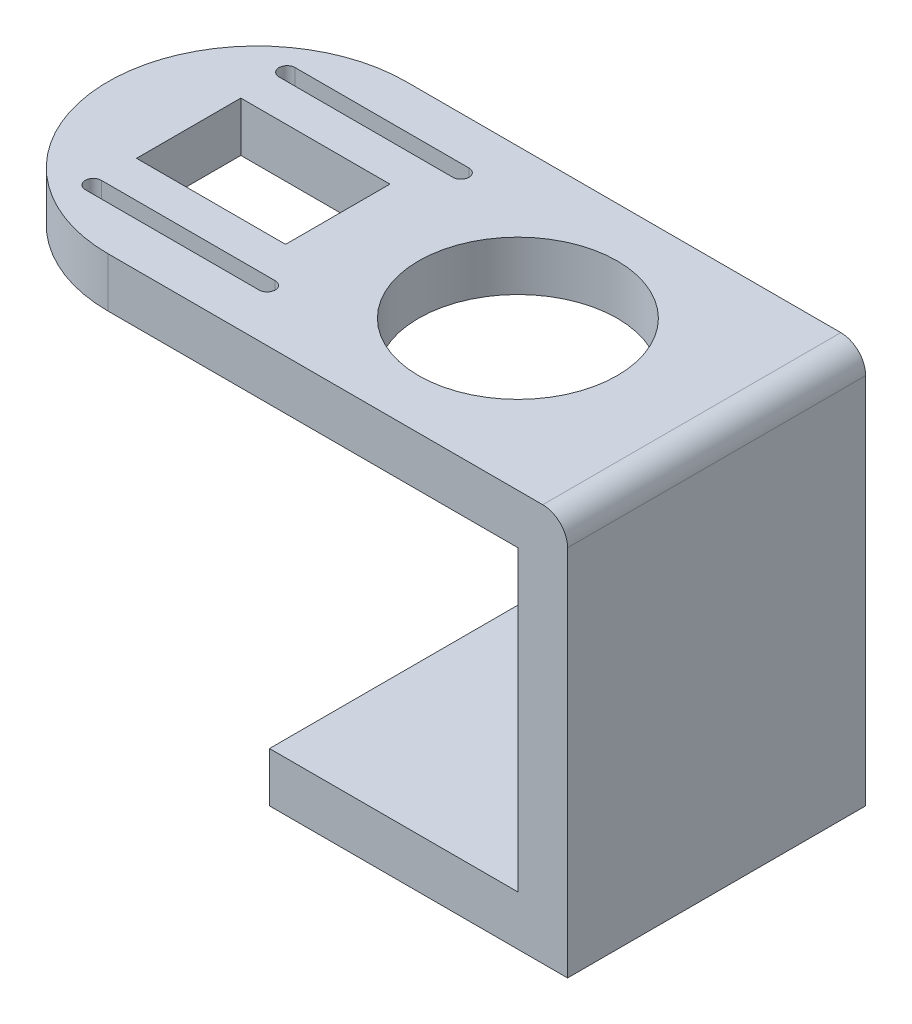
from build123d import *

# Parameters (mm, degrees)
SKETCH4_W                    = 20
SKETCH4_H                    = 120
SKETCH4_W_2                  = 120
SKETCH4_H_2                  = 20
SKETCH4_W_3                  = 160
BOSS_EXTRUDE3_DEPTH          = 120
BOSS_EXTRUDE4_DEPTH          = 20
SKETCH21_R                   = 40
CUT_EXTRUDE3_DEPTH           = 25
SKETCH24_W                   = 15
SKETCH24_H                   = 20
SPLIT1_START                 = 97.450277265
SPLIT1_OUTLINE_R             = 45
SPLIT1_OUTLINE_R_2           = 25.75
SPLIT1_DEPTH                 = 42.549722735
SPLIT1_2_DEPTH               = 42.549722735
SPLIT1_3_OUTLINE_R           = 25.75
SPLIT1_3_DEPTH               = 6
SPLIT1_START_2               = 103.450277265
SPLIT1_4_DEPTH               = 8.549722735
SPLIT1_START_3               = 132
SPLIT1_5_DEPTH               = 8
F_5_0_5_DIAMETER_HOLE1_D     = 5
F_5_0_5_DIAMETER_HOLE1_DEPTH = 2.497848452
F_5_0_5_DIAMETER_HOLE1_TIP   = 1.502151548
CUT_EXTRUDE4_DEPTH           = 317.267292017
CUT_EXTRUDE5_DEPTH           = 307.634962129
CUT_EXTRUDE5_DEPTH_BACK      = 307.634962129
FILLET1_R                    = 10


# Read off the part's stored shape, not the designer's step: Split1
with BuildPart() as part:
    # Sketch4 → Boss-Extrude3 (new body)
    with BuildSketch(Plane.XY):
        with Locations((-10, 80)):
            Rectangle(SKETCH4_W, SKETCH4_H)
        with Locations((-60, 10)):
            Rectangle(SKETCH4_W_2, SKETCH4_H_2)
        with Locations((-80, 150)):
            Rectangle(SKETCH4_W_3, SKETCH4_H_2)
    extrude(amount=BOSS_EXTRUDE3_DEPTH)

    # Sketch20 → Boss-Extrude4 (add)
    with BuildSketch(Plane(origin=(0, 160, 0), x_dir=(1, 0, 0), z_dir=(0, 1, 0))):
        with BuildLine():
            Line((-185, -120), (-160, -120))
            Line((-160, -120), (-160, 0))
            Line((-160, 0), (-185, 0))
            ThreePointArc((-185, 0), (-245, -60), (-185, -120))
        make_face()
    extrude(amount=-BOSS_EXTRUDE4_DEPTH)

    # Sketch21 → Cut-Extrude3 (cut)
    with BuildSketch(Plane.XZ.offset(-140)):
        with Locations(Location((-80, 60, 0), (0, 0, 270))):
            Circle(SKETCH21_R)
    extrude(amount=-CUT_EXTRUDE3_DEPTH, mode=Mode.SUBTRACT)

    # Sketch23 → Revolve1 (revolve)
    with BuildSketch(Plane(origin=(0, 0, 60), x_dir=(-1, 0, 0), z_dir=(0, 0, -1)), mode=Mode.PRIVATE) as revolve1_sk:
        Polygon((125, 140), (120, 140), (120, 103.450277265), (105.75, 103.450277265), (105.75, 97.450277265), (125, 97.450277265), align=None)
    revolve(revolve1_sk.sketch.rotate(Axis((-80, 160, 60), (0, -1, 0)), 270), axis=Axis((-80, 160, 60), (0, -1, 0)))

    # Cut-Sweep1: sweep along a path in Sketch25
    with BuildLine(Plane(origin=(0, 132, 0), x_dir=(-1, 0, 0), z_dir=(0, -1, 0))) as cut_sweep1_path:
        Line((125, -80.343984431), (80, -90))
        ThreePointArc((80, -90), (50, -60), (80, -30))
        Line((80, -30), (125, -39.656015569))
    # Sketch24 → Cut-Sweep1 (sweep, cut)
    with BuildSketch(Plane.ZY.offset(125)):
        with Locations((37.5, 122)):
            Rectangle(SKETCH24_W, SKETCH24_H)
    sweep(path=cut_sweep1_path.line, transition=Transition.RIGHT, mode=Mode.SUBTRACT)

    # Split1 outline → Split1 (cut)
    with BuildSketch(Plane(origin=(0, 0, 0), x_dir=(1, 0, 0), z_dir=(0, 1, 0)).offset(SPLIT1_START)):
        with Locations((-80, -60)):
            Circle(SPLIT1_OUTLINE_R)
        with Locations((-80, -60)):
            Circle(SPLIT1_OUTLINE_R_2, mode=Mode.SUBTRACT)
    extrude(amount=SPLIT1_DEPTH, mode=Mode.SUBTRACT)

    # Ø5.0 (5) Diameter Hole1
    with Locations(Plane(origin=(0, 140, 0), x_dir=(-1, 0, 0), z_dir=(0, -1, 0))):
        with Locations((53.75, -14.533666301), (132.5, -60), (53.75, -105.466333699)):
            Hole(F_5_0_5_DIAMETER_HOLE1_D / 2, depth=F_5_0_5_DIAMETER_HOLE1_DEPTH)
            with Locations((0, 0, -(F_5_0_5_DIAMETER_HOLE1_DEPTH + F_5_0_5_DIAMETER_HOLE1_TIP / 2))):  # 118° drill point
                Cone(0, F_5_0_5_DIAMETER_HOLE1_D / 2, F_5_0_5_DIAMETER_HOLE1_TIP, mode=Mode.SUBTRACT)

    # Sketch19 → Cut-Extrude4 (cut, through all)
    with BuildSketch(Plane(origin=(0, 160, 0), x_dir=(1, 0, 0), z_dir=(0, 1, 0))):
        Polygon((-152.526760948, -69.999980109), (-152.526760948, -81), (-212.526760948, -81), (-212.526760948, -39), (-152.526760948, -39), (-152.526760948, -50.000019891), align=None)
    extrude(amount=-CUT_EXTRUDE4_DEPTH, mode=Mode.SUBTRACT)

    # Sketch30 → Cut-Extrude5 (cut, two sides: drawn at the far end of the back side and taken through both)
    with BuildSketch(Plane.XZ.offset(-140).offset(-CUT_EXTRUDE5_DEPTH_BACK)):
        with BuildLine():
            Line((-212.234124069, 23.95), (-142.234124069, 23.95))
            ThreePointArc((-142.234124069, 23.95), (-138.984124069, 20.7), (-142.234124069, 17.45))
            Line((-142.234124069, 17.45), (-212.234124069, 17.45))
            ThreePointArc((-212.234124069, 17.45), (-215.484124069, 20.7), (-212.234124069, 23.95))
        make_face()
        with BuildLine():
            Line((-211.937175822, 102.25), (-141.937175822, 102.25))
            ThreePointArc((-141.937175822, 102.25), (-138.687175822, 99), (-141.937175822, 95.75))
            Line((-141.937175822, 95.75), (-211.937175822, 95.75))
            ThreePointArc((-211.937175822, 95.75), (-215.187175822, 99), (-211.937175822, 102.25))
        make_face()
    extrude(amount=CUT_EXTRUDE5_DEPTH + CUT_EXTRUDE5_DEPTH_BACK, mode=Mode.SUBTRACT)

    # Fillet1
    fillet1_edges = [part.edges().sort_by_distance(p)[0] for p in [
        (0, 160, 60),
    ]]
    fillet(fillet1_edges, radius=FILLET1_R)


with BuildPart() as body_2:
    # Split1 2 outline → Split1 2 (new body)
    with BuildSketch(Plane(origin=(0, 0, 0), x_dir=(1, 0, 0), z_dir=(0, 1, 0)).offset(SPLIT1_START)):
        with BuildLine():
            ThreePointArc((-97.74561888, -24.151806035), (-40, -60), (-97.74561888, -95.848193965))
            Line((-97.74561888, -95.848193965), (-110.465485891, -93.118788767))
            ThreePointArc((-110.465485891, -93.118788767), (-35, -60), (-110.465485891, -26.881211233))
            Line((-110.465485891, -26.881211233), (-97.74561888, -24.151806035))
        make_face()
        with BuildLine():
            ThreePointArc((-116.266630075, -76.873990133), (-120, -60), (-116.266630075, -43.126009867))
            Line((-116.266630075, -43.126009867), (-122.209965285, -44.401319586))
            ThreePointArc((-122.209965285, -44.401319586), (-125, -60), (-122.209965285, -75.598680414))
            Line((-122.209965285, -75.598680414), (-116.266630075, -76.873990133))
        make_face()
    extrude(amount=SPLIT1_2_DEPTH)

    # Split1 3 outline → Split1 3 (add)
    with BuildSketch(Plane(origin=(0, 0, 0), x_dir=(1, 0, 0), z_dir=(0, 1, 0)).offset(SPLIT1_START)):
        with BuildLine():
            ThreePointArc((-97.74561888, -95.848193965), (-40, -60), (-97.74561888, -24.151806035))
            Line((-97.74561888, -24.151806035), (-110.465485891, -26.881211233))
            ThreePointArc((-110.465485891, -26.881211233), (-117.378721889, -34.94344098), (-122.209965285, -44.401319586))
            Line((-122.209965285, -44.401319586), (-116.266630075, -43.126009867))
            ThreePointArc((-116.266630075, -43.126009867), (-120, -60), (-116.266630075, -76.873990133))
            Line((-116.266630075, -76.873990133), (-122.209965285, -75.598680414))
            ThreePointArc((-122.209965285, -75.598680414), (-117.378721889, -85.05655902), (-110.465485891, -93.118788767))
            Line((-110.465485891, -93.118788767), (-97.74561888, -95.848193965))
        make_face()
        with Locations((-80, -60)):
            Circle(SPLIT1_3_OUTLINE_R, mode=Mode.SUBTRACT)
    extrude(amount=SPLIT1_3_DEPTH)

    # Split1 4 outline → Split1 4 (add)
    with BuildSketch(Plane(origin=(0, 0, 0), x_dir=(1, 0, 0), z_dir=(0, 1, 0)).offset(SPLIT1_START_2)):
        with BuildLine():
            ThreePointArc((-116.266630075, -43.126009867), (-108.624043426, -32.059632466), (-97.74561888, -24.151806035))
            Line((-97.74561888, -24.151806035), (-110.465485891, -26.881211233))
            ThreePointArc((-110.465485891, -26.881211233), (-117.378721889, -34.94344098), (-122.209965285, -44.401319586))
            Line((-122.209965285, -44.401319586), (-116.266630075, -43.126009867))
        make_face()
        with BuildLine():
            Line((-110.465485891, -93.118788767), (-97.74561888, -95.848193965))
            ThreePointArc((-97.74561888, -95.848193965), (-108.624043426, -87.940367534), (-116.266630075, -76.873990133))
            Line((-116.266630075, -76.873990133), (-122.209965285, -75.598680414))
            ThreePointArc((-122.209965285, -75.598680414), (-117.378721889, -85.05655902), (-110.465485891, -93.118788767))
        make_face()
    extrude(amount=SPLIT1_4_DEPTH)

    # Split1 5 outline → Split1 5 (add)
    with BuildSketch(Plane(origin=(0, 0, 0), x_dir=(1, 0, 0), z_dir=(0, 1, 0)).offset(SPLIT1_START_3)):
        with BuildLine():
            ThreePointArc((-116.266630075, -43.126009867), (-108.624043426, -32.059632466), (-97.74561888, -24.151806035))
            Line((-97.74561888, -24.151806035), (-110.465485891, -26.881211233))
            ThreePointArc((-110.465485891, -26.881211233), (-117.378721889, -34.94344098), (-122.209965285, -44.401319586))
            Line((-122.209965285, -44.401319586), (-116.266630075, -43.126009867))
        make_face()
        with BuildLine():
            Line((-110.465485891, -93.118788767), (-97.74561888, -95.848193965))
            ThreePointArc((-97.74561888, -95.848193965), (-108.624043426, -87.940367534), (-116.266630075, -76.873990133))
            Line((-116.266630075, -76.873990133), (-122.209965285, -75.598680414))
            ThreePointArc((-122.209965285, -75.598680414), (-117.378721889, -85.05655902), (-110.465485891, -93.118788767))
        make_face()
    extrude(amount=SPLIT1_5_DEPTH)


solid = part.part
